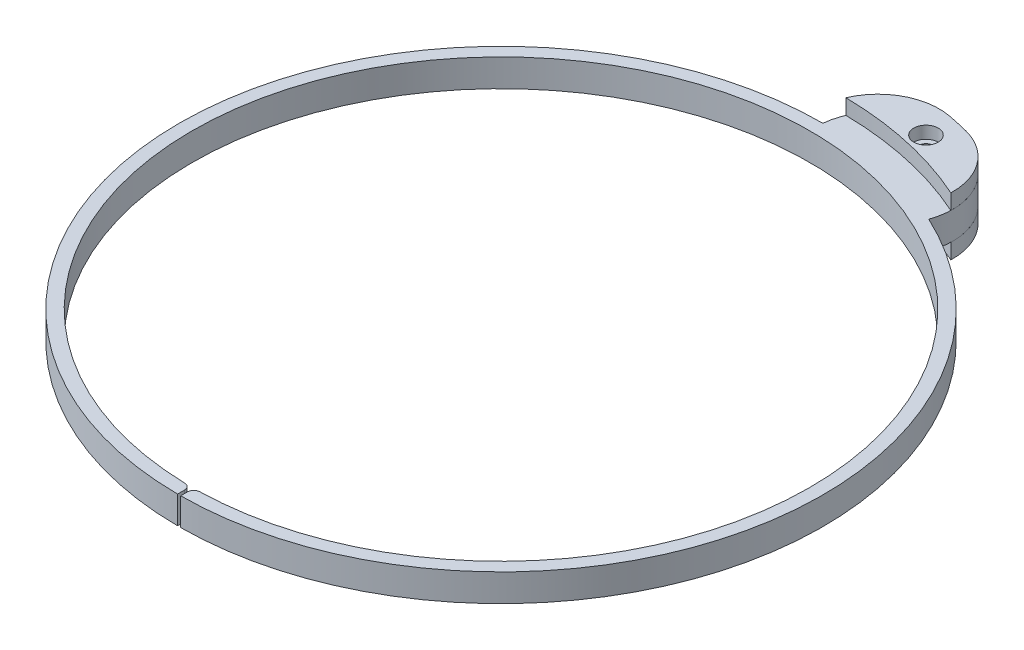
from build123d import *
from build123d.topology import SkipClean

# Parameters (mm, degrees)
SKETCH1_R               = 105.25
SKETCH1_R_2             = 101
BOSS_EXTRUDE1_DEPTH     = 9
SKETCH2_W               = 20
SKETCH2_H               = 9
REVOLVE1_ANGLE          = 25
FILLET1_R               = 20
BOSS_EXTRUDE3_DEPTH     = 5
BOSS_EXTRUDE4_START     = 5
SKETCH7_R               = 2.25
BOSS_EXTRUDE4_DEPTH     = 5
CUT_EXTRUDE1_DEPTH      = 164.259690069
CUT_EXTRUDE1_DEPTH_BACK = 3
CUT_EXTRUDE2_DEPTH      = 163.753575695
CUT_EXTRUDE2_DEPTH_BACK = 163.753575695
SKETCH9_W               = 1
SKETCH9_H               = 21.725732916
FILLET2_R               = 2


# Read off the part's stored shape, not the designer's step: Split1, Split2
with BuildPart() as part:
    # Sketch1 → Boss-Extrude1 (new body)
    with BuildSketch(Plane(origin=(0, 0, 0), x_dir=(1, 0, 0), z_dir=(0, 1, 0))):
        with Locations(Location((0, 0, 0), (0, 0, 270))):
            Circle(SKETCH1_R)
        with Locations(Location((0, 0, 0), (0, 0, 270))):
            Circle(SKETCH1_R_2, mode=Mode.SUBTRACT)
    extrude(amount=BOSS_EXTRUDE1_DEPTH)

    # Sketch2 → Revolve1 (revolve)
    with BuildSketch(Plane(origin=(0, 0, 0), x_dir=(0, 0, -1), z_dir=(1, 0, 0))):
        with Locations((115.25, 4.5)):
            Rectangle(SKETCH2_W, SKETCH2_H)
    revolve(axis=Axis((0, 9, 0), (0, -1, 0)), revolution_arc=REVOLVE1_ANGLE)

    # Fillet1
    # the kernel refuses this fillet: 20 mm, written as the material it takes off along each edge
    with BuildSketch(Plane(origin=(0, -59.501187648, -125.25), x_dir=(0.9954761390042871, 0, 0.09501187648455978), z_dir=(0, 1, 0))) as fillet1_piece_1:
        with BuildLine():
            CenterArc((21.90023753, -19.90952278), FILLET1_R, 84.547996623, 95.452003377)
            Line((1.90023753, -19.90952278), (1.50023753, -19.90952278))
            ThreePointArc((1.50023753, -19.90952278), (0.551928309, -9.992766141), (-0.398190456, -0.038004751))
            Line((-0.398190456, -0.038004751), (-0.038004751, 0.398190456))
            ThreePointArc((-0.038004751, 0.398190456), (11.90023753, 0.96661359), (23.83847981, 0.398190456))
            Line((23.83847981, 0.398190456), (23.800475059, 0))
        make_face()
    extrude(amount=128.002375297, mode=Mode.SUBTRACT)
    with BuildSketch(Plane(origin=(52.932937283, -59.501187648, -113.515050326), x_dir=(-0.4226182617406998, 0, 0.9063077870366498), z_dir=(0, 1, 0))) as fillet1_piece_2:
        with BuildLine():
            CenterArc((21.90023753, -19.90952278), FILLET1_R, 95.452003377, 95.452003377)
            Line((2.261327797, -23.692805019), (1.868549602, -23.768470663))
            ThreePointArc((1.868549602, -23.768470663), (0.168423134, -11.93824228), (-0.4, 0))
            Line((-0.4, 0), (0, 0.4))
            ThreePointArc((0, 0.4), (10, 0.4), (19.961995249, 0.398190456))
            Line((19.961995249, 0.398190456), (20, 0))
        make_face()
    extrude(amount=128.002375297, mode=Mode.SUBTRACT)

    # Sketch3 → Boss-Extrude3 (add)
    with BuildSketch(Plane(origin=(0, 9, 0), x_dir=(1, 0, 0), z_dir=(0, 1, 0))):
        with BuildLine():
            ThreePointArc((45.623840254, 101.464415932), (41.591560528, 114.136329191), (30.504285175, 121.478603408))
            ThreePointArc((30.504285175, 121.478603408), (27.109061646, 122.281074892), (23.692805019, 122.988672203))
            ThreePointArc((23.692805019, 122.988672203), (10.541341863, 121.019996943), (1.531473393, 111.239458329))
            ThreePointArc((1.531473393, 111.239458329), (24.078907051, 108.612930792), (45.623840254, 101.464415932))
        make_face()
    extrude(amount=BOSS_EXTRUDE3_DEPTH)


with BuildPart() as body_2:
    # Split1: the piece on the far side of the plane
    add(part.part)
    split(bisect_by=Plane(origin=(0, 9, 0), x_dir=(1, 0, 0), z_dir=(0, 1, 0)), keep=Keep.BOTTOM)


with BuildPart() as part_1:
    add(part.part)

    # Split1
    split(bisect_by=Plane(origin=(0, 9, 0), x_dir=(1, 0, 0), z_dir=(0, 1, 0)), keep=Keep.TOP)


with BuildPart() as cbore_for_m4_shcs1_tool:
    # Sketch6 → CBORE for M4 SHCS1 (revolve)
    with BuildSketch(Plane(origin=(25.216346049, 14, -113.743586553), x_dir=(0, 0, 1), z_dir=(1, 0, 0))):
        Polygon((0, 0), (0, 14), (2.25, 14), (2.25, 4), (4, 4), (4, 0), align=None)
    revolve(axis=Axis((25.216346049, 20.35, -113.743586553), (0, -1, 0)))


with BuildPart() as part_2:
    add(part_1.part)

    # CBORE for M4 SHCS1: cut by cbore_for_m4_shcs1_tool
    add(cbore_for_m4_shcs1_tool.part, mode=Mode.SUBTRACT)


with BuildPart() as body_2_1:
    add(body_2.part)

    # CBORE for M4 SHCS1: cut by cbore_for_m4_shcs1_tool
    add(cbore_for_m4_shcs1_tool.part, mode=Mode.SUBTRACT)

    # Sketch7 → Boss-Extrude4 (add)
    # profile 1 of 2: a face of its own
    with SkipClean():  # the faces are left unmerged after this step: merging them gives an invalid solid
        with BuildSketch(Plane.XZ.offset(BOSS_EXTRUDE4_START)):
            with BuildLine():
                ThreePointArc((45.623840254, -101.464415932), (24.078907051, -108.612930792), (1.531473393, -111.239458329))
                ThreePointArc((1.531473393, -111.239458329), (10.541341863, -121.019996943), (23.692805019, -122.988672203))
                ThreePointArc((23.692805019, -122.988672203), (27.109061646, -122.281074892), (30.504285175, -121.478603408))
                ThreePointArc((30.504285175, -121.478603408), (41.591560528, -114.136329191), (45.623840254, -101.464415932))
            make_face()
            Polygon((25.443065501, -109.130352154), (29.324883958, -111.633314159), (29.098164506, -116.246548558), (24.989626597, -118.356820953), (21.107808139, -115.853858948), (21.334527591, -111.240624549), align=None, mode=Mode.SUBTRACT)
        # profile 2 of 2: a face of its own
        with BuildSketch(Plane.XZ.offset(BOSS_EXTRUDE4_START)):
            Polygon((24.989626597, -118.356820953), (29.098164506, -116.246548558), (29.324883958, -111.633314159), (25.443065501, -109.130352154), (21.334527591, -111.240624549), (21.107808139, -115.853858948), align=None)
            with Locations(Location((25.216346049, -113.743586553, 0), (0, 0, 90))):
                Circle(SKETCH7_R, mode=Mode.SUBTRACT)
        extrude(amount=-BOSS_EXTRUDE4_DEPTH)

    # Sketch8 → Cut-Extrude1 (cut, two sides: drawn at the far end of the back side and taken through both)
    with SkipClean():  # the faces are left unmerged after this step: merging them gives an invalid solid
        with BuildSketch(Plane.XZ.offset(5).offset(-CUT_EXTRUDE1_DEPTH_BACK)):
            Polygon((29.791855737, -113.112678931), (26.957718864, -109.465625117), (22.382209176, -110.096532739), (20.640836361, -114.374494176), (23.474973233, -118.02154799), (28.050482921, -117.390640367), align=None)
        extrude(amount=CUT_EXTRUDE1_DEPTH + CUT_EXTRUDE1_DEPTH_BACK, mode=Mode.SUBTRACT)


with BuildPart() as body_3:
    # Split2: the piece on the far side of the plane
    add(body_2_1.part)
    split(bisect_by=Plane(origin=(0, 0, 0), x_dir=(1, 0, 0), z_dir=(0, 1, 0)), keep=Keep.BOTTOM)


with BuildPart() as body_2_2:
    add(body_2_1.part)

    # Split2
    split(bisect_by=Plane(origin=(0, 0, 0), x_dir=(1, 0, 0), z_dir=(0, 1, 0)), keep=Keep.TOP)

    # Sketch9 → Cut-Extrude2 (cut, two sides: drawn at the far end of the back side and taken through both)
    with BuildSketch(Plane(origin=(0, 9, 0), x_dir=(1, 0, 0), z_dir=(0, 1, 0)).offset(-CUT_EXTRUDE2_DEPTH_BACK)):
        with Locations((0, -105.25)):
            Rectangle(SKETCH9_W, SKETCH9_H)
    extrude(amount=CUT_EXTRUDE2_DEPTH + CUT_EXTRUDE2_DEPTH_BACK, mode=Mode.SUBTRACT)

    # Fillet2
    fillet2_edges = [body_2_2.edges().sort_by_distance(p)[0] for p in [
        (-0.5, 4.5, 100.998762369),
        (0.5, 4.5, 100.998762369),
    ]]
    fillet(fillet2_edges, radius=FILLET2_R)


solid = Compound([part_2.part, body_3.part, body_2_2.part])
